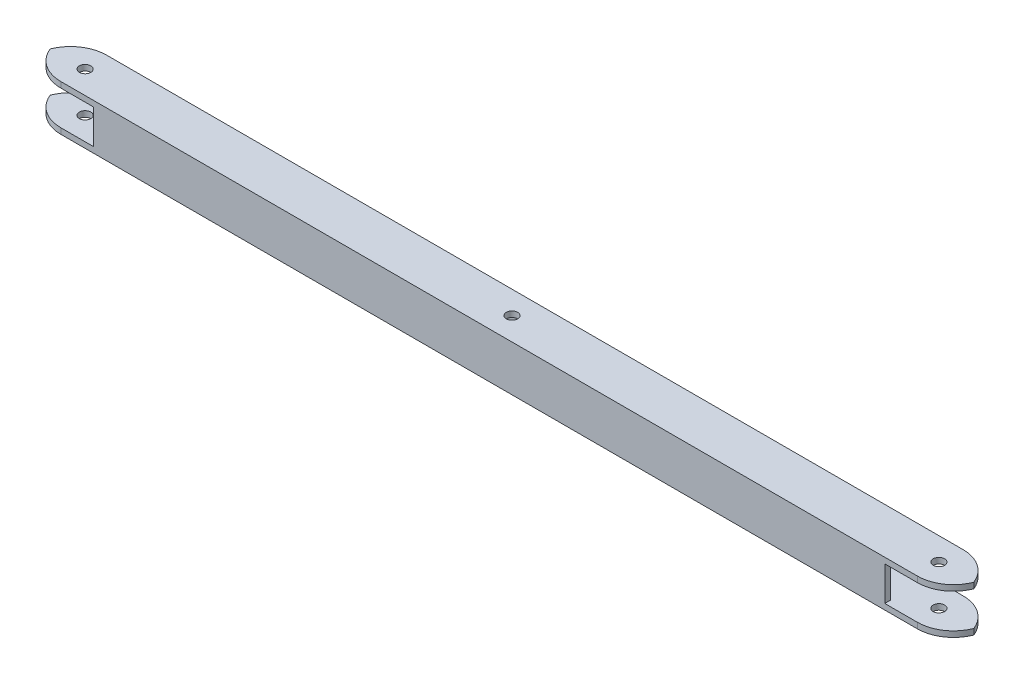
from build123d import *

# Parameters (mm, degrees)
SKETCH1_W           = 515.5
SKETCH1_H           = 25.4
SKETCH1_R           = 3.175
BOSS_EXTRUDE1_DEPTH = 25.4
CUT_EXTRUDE1_REACH  = 518.75
SKETCH2_W           = 19.05
SKETCH2_H           = 19.05
SKETCH4_W           = 25.4
SKETCH4_H           = 19.05
CUT_EXTRUDE2_DEPTH  = 38.1
FILLET1_R           = 20


with BuildPart() as part:
    # Sketch1 → Boss-Extrude1 (new body)
    with BuildSketch(Plane(origin=(0, 0, 0), x_dir=(1, 0, 0), z_dir=(0, 1, 0))):
        with Locations((257.75, -12.7)):
            Rectangle(SKETCH1_W, SKETCH1_H)
        with Locations(Location((257.75, -12.7, 0), (0, 0, 270))):
            Circle(SKETCH1_R, mode=Mode.SUBTRACT)
        with Locations(Location((20.76, -12.7, 0), (0, 0, 270))):
            Circle(SKETCH1_R, mode=Mode.SUBTRACT)
        with Locations(Location((494.74, -12.7, 0), (0, 0, 90))):
            Circle(SKETCH1_R, mode=Mode.SUBTRACT)
    extrude(amount=BOSS_EXTRUDE1_DEPTH)

    # Cut-Extrude1: up to this face of the body (flat: up to its plane)
    cut_extrude1_end = Plane(part.part.faces().sort_by_distance((515.5, 12.7, 12.7))[0])
    # Sketch2 → Cut-Extrude1 (cut, up to the picked face)
    with BuildSketch(Plane.ZY, mode=Mode.PRIVATE) as cut_extrude1_sk1:
        with Locations((12.7, 12.7)):
            Rectangle(SKETCH2_W, SKETCH2_H)
    cut_extrude1_tool1 = split(extrude(cut_extrude1_sk1.sketch, amount=-CUT_EXTRUDE1_REACH, mode=Mode.PRIVATE), bisect_by=cut_extrude1_end, keep=Keep.BOTH, mode=Mode.PRIVATE)
    add(cut_extrude1_tool1.solids().sort_by(Axis((0, 12.7, 12.7), (1, 0, 0)))[0], mode=Mode.SUBTRACT)

    # Sketch4 → Cut-Extrude2 (cut)
    with BuildSketch(Plane.ZY):
        with Locations((12.7, 12.7)):
            Rectangle(SKETCH4_W, SKETCH4_H)
    cut_extrude2 = extrude(amount=-CUT_EXTRUDE2_DEPTH, mode=Mode.SUBTRACT)

    # Mirror1: Cut-Extrude2 across plane
    add(cut_extrude2.mirror(Plane.ZY.offset(-257.75)), mode=Mode.SUBTRACT)

    # Fillet1
    # the kernel refuses this fillet: 20 mm, written as the material it takes off along each edge
    with BuildSketch(Plane(origin=(515.5, -50, 0), x_dir=(-1, 0, 0), z_dir=(0, 1, 0)), Plane(origin=(515.5, -27.775, 0), x_dir=(-1, 0, 0), z_dir=(0, 1, 0)), Plane(origin=(0, -27.775, 25.4), x_dir=(1, 0, 0), z_dir=(0, 1, 0))) as fillet1_piece_1:
        with BuildLine():
            CenterArc((FILLET1_R, FILLET1_R), FILLET1_R, 180, 90)
            Line((0, FILLET1_R), (0, 0))
            Line((0, 0), (FILLET1_R, 0))
        make_face()
    extrude(amount=103.175, mode=Mode.SUBTRACT)
    with BuildSketch(Plane(origin=(515.5, -50, 25.4), x_dir=(-1, 0, 0), z_dir=(0, 1, 0)), Plane(origin=(515.5, -27.775, 25.4), x_dir=(-1, 0, 0), z_dir=(0, 1, 0)), Plane(origin=(0, -50, 25.4), x_dir=(0, 0, -1), z_dir=(0, 1, 0)), Plane(origin=(0, -50, 0), x_dir=(1, 0, 0), z_dir=(0, 1, 0)), Plane(origin=(0, -27.775, 0), x_dir=(1, 0, 0), z_dir=(0, 1, 0))) as fillet1_piece_2:
        with BuildLine():
            CenterArc((FILLET1_R, -FILLET1_R), FILLET1_R, 90, 90)
            Line((0, -FILLET1_R), (0, 0))
            Line((0, 0), (FILLET1_R, 0))
        make_face()
    extrude(amount=103.175, mode=Mode.SUBTRACT)


solid = part.part
